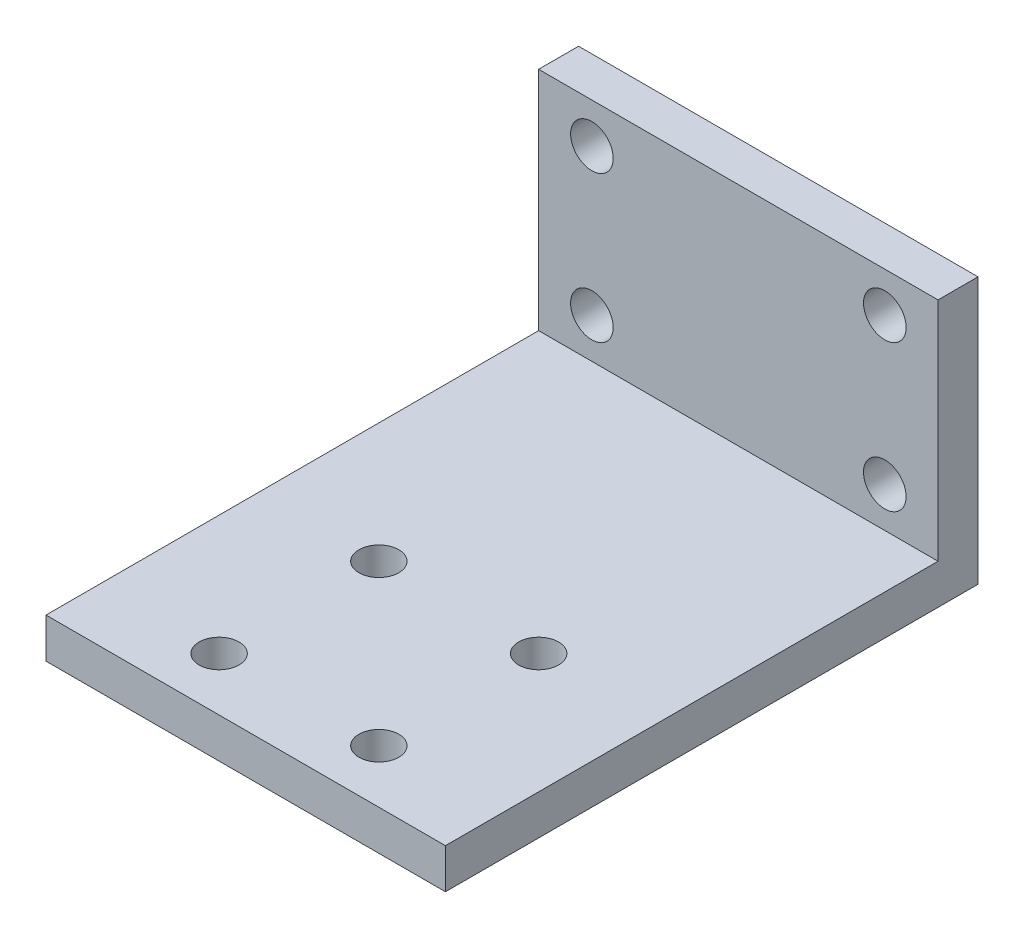
from build123d import *

# Parameters (mm, degrees)
SKETCH_1_W          = 30
SKETCH_1_H          = 40
EXTRUDE_1_DEPTH     = 3
SKETCH_2_W          = 30
SKETCH_2_H          = 3
EXTRUDE_2_DEPTH     = 17
SKETCH_3_R          = 1.6
CUT_EXTRUDE_1_DEPTH = 17
SKETCH_4_R          = 1.5
CUT_EXTRUDE_2_DEPTH = 10


with BuildPart() as part:
    # 草图1 → 凸台-拉伸1 (new body)
    with BuildSketch(Plane(origin=(0, 0, 0), x_dir=(1, 0, 0), z_dir=(0, 1, 0))):
        with Locations((-6.335311573, -13.086053412)):
            Rectangle(SKETCH_1_W, SKETCH_1_H)
    extrude(amount=EXTRUDE_1_DEPTH)

    # 草图2 → 凸台-拉伸2 (add)
    with BuildSketch(Plane(origin=(0, 3, 0), x_dir=(1, 0, 0), z_dir=(0, 1, 0))):
        with Locations((-6.335311573, 5.413946588)):
            Rectangle(SKETCH_2_W, SKETCH_2_H)
    extrude(amount=EXTRUDE_2_DEPTH)

    # 草图3 → 切除-拉伸1 (cut)
    with BuildSketch(Plane.XY.offset(-3.913946588)):
        with Locations((-17.335311573, 17)):
            Circle(SKETCH_3_R)
        with Locations((4.664688427, 17)):
            Circle(SKETCH_3_R)
        with Locations((-17.335311573, 6)):
            Circle(SKETCH_3_R)
        with Locations((4.664688427, 6)):
            Circle(SKETCH_3_R)
    extrude(amount=-CUT_EXTRUDE_1_DEPTH, mode=Mode.SUBTRACT)

    # 草图4 → 切除-拉伸2 (cut)
    with BuildSketch(Plane.XZ):
        with Locations((-0.335311573, 17.086053412)):
            Circle(SKETCH_4_R)
        with Locations((-0.335311573, 29.086053412)):
            Circle(SKETCH_4_R)
        with Locations((-12.335311573, 29.086053412)):
            Circle(SKETCH_4_R)
        with Locations((-12.335311573, 17.086053412)):
            Circle(SKETCH_4_R)
    extrude(amount=-CUT_EXTRUDE_2_DEPTH, mode=Mode.SUBTRACT)


solid = part.part
